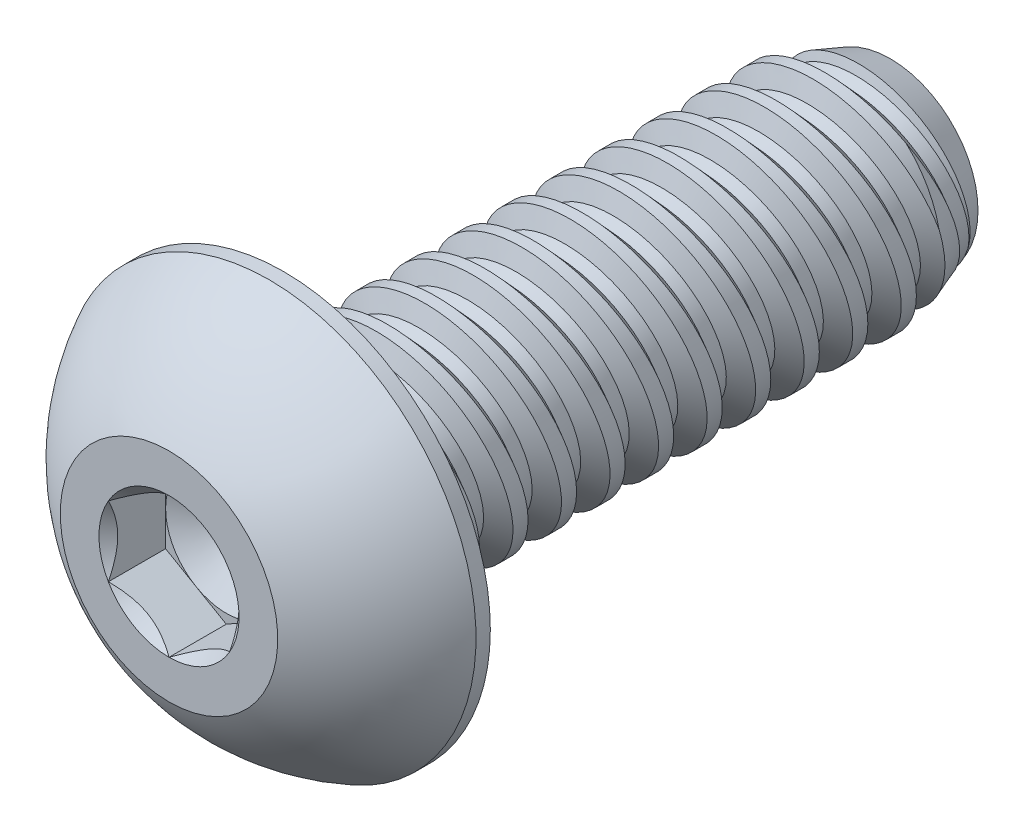
from build123d import *

# Parameters (mm, degrees)
SKETCH1_W          = 7.9375
SKETCH1_H          = 1.4224
LPATTERN1_COUNT    = 13
LPATTERN1_PITCH    = 0.635
LPATTERN2_COUNT    = 2
LPATTERN2_PITCH    = 0.635
SKETCH4_R          = 2.7051
EXTRUDE1_DEPTH     = 1.4986
CUT_EXTRUDE1_DEPTH = 0.7493
SKETCH7_R          = 0.916543552
CUT_EXTRUDE4_DEPTH = 0.7493
CUT_EXTRUDE4_DRAFT = -45
SKETCH8_R          = 0.79375
CUT_EXTRUDE5_DEPTH = 0.249766667
CUT_EXTRUDE5_DRAFT = -60


with BuildPart() as part:
    # Sketch1 → Revolve1 (revolve)
    with BuildSketch(Plane(origin=(0, 0, 0), x_dir=(0, 0, -1), z_dir=(1, 0, 0)), mode=Mode.PRIVATE) as revolve1_sk:
        with Locations((3.96875, 0.7112)):
            Rectangle(SKETCH1_W, SKETCH1_H)
    revolve(revolve1_sk.sketch.rotate(Axis((0, 0, 0), (0, 0, 1)), 125.388824972), axis=Axis((0, 0, 0), (0, 0, 1)))

    # Sketch2 → Cut-Revolve1 (revolve, cut)
    with BuildSketch(Plane(origin=(0, 0, 0), x_dir=(0, 0, -1), z_dir=(1, 0, 0)), mode=Mode.PRIVATE) as cut_revolve1_sk:
        Polygon((0.077468538, 1.439692084), (0.619748307, 1.560736676), (0.500953883, 1.182057853), (0.346016806, 1.147473684), align=None)
    cut_revolve1 = revolve(cut_revolve1_sk.sketch.rotate(Axis((0, -0.152561988, 0), (0, 0.21785303258717023, -0.9759815859905213)), 180), axis=Axis((0, -0.152561988, 0), (0, 0.21785303258717023, -0.9759815859905213)), mode=Mode.SUBTRACT)

    # Sketch3 → Cut-Revolve2 (revolve, cut)
    with BuildSketch(Plane(origin=(0, 0, 0), x_dir=(0, 0, -1), z_dir=(1, 0, 0)), mode=Mode.PRIVATE) as cut_revolve2_sk:
        Polygon((7.9375, 1.147473684), (7.182146156, 1.4224), (7.9375, 1.4224), align=None)
    revolve(cut_revolve2_sk.sketch.rotate(Axis((0, 0, -7.182146156), (0, 0, 1)), 125.388824972), axis=Axis((0, 0, -7.182146156), (0, 0, 1)), mode=Mode.SUBTRACT)

    # LPattern1: Cut-Revolve1 ×13
    with Locations(*[(0, 0, -i * LPATTERN1_PITCH) for i in range(1, LPATTERN1_COUNT)]):
        add(cut_revolve1, mode=Mode.SUBTRACT)

    # LPattern2: Cut-Revolve1 ×2
    with Locations(*[(0, 0, i * LPATTERN2_PITCH) for i in range(1, LPATTERN2_COUNT)]):
        add(cut_revolve1, mode=Mode.SUBTRACT)

    # Sketch4 → Extrude1 (add)
    with BuildSketch(Plane.XY):
        with Locations(Location((0, 0, 0), (0, 0, 90))):
            Circle(SKETCH4_R)
    extrude(amount=EXTRUDE1_DEPTH)

    # Sketch9 → Cut-Revolve3 (revolve, cut)
    with BuildSketch(Plane(origin=(0, 0, 0), x_dir=(0, 0, -1), z_dir=(1, 0, 0)), mode=Mode.PRIVATE) as cut_revolve3_sk:
        with BuildLine():
            Line((0, 2.7051), (-0.187325, 2.7051))
            ThreePointArc((-0.187325, 2.7051), (-0.942390011, 2.16539248), (-1.4986, 1.4224))
            Line((-1.4986, 1.4224), (-1.685925, 1.4224))
            Line((-1.685925, 1.4224), (-1.685925, 2.892425))
            Line((-1.685925, 2.892425), (0, 2.892425))
            Line((0, 2.892425), (0, 2.7051))
        make_face()
    revolve(cut_revolve3_sk.sketch.rotate(Axis((0, 0, 0), (0, 0, 1)), 199.295778605), axis=Axis((0, 0, 0), (0, 0, 1)), mode=Mode.SUBTRACT)

    # Sketch6 → Cut-Extrude1 (cut)
    with BuildSketch(Plane.XY.offset(1.4986)):
        Polygon((0, -0.916543552), (0.79375, -0.458271776), (0.79375, 0.458271776), (0, 0.916543552), (-0.79375, 0.458271776), (-0.79375, -0.458271776), align=None)
    extrude(amount=-CUT_EXTRUDE1_DEPTH, mode=Mode.SUBTRACT)


with BuildPart() as cut_extrude4_tool:
    # Sketch7 → Cut-Extrude4 (with draft: the straight prism first)
    with BuildSketch(Plane.XY.offset(1.4986)):
        Circle(SKETCH7_R)
    extrude(amount=-CUT_EXTRUDE4_DEPTH)
    # Cut-Extrude4: the draft: its side faces are tilted about the plane it starts from
    cut_extrude4_sides = [cut_extrude4_tool.faces().sort_by_distance(p)[0] for p in [
        (-0.916543552, 0, 1.12395),
    ]]
    draft(cut_extrude4_sides, Plane.XY.offset(1.4986), CUT_EXTRUDE4_DRAFT)


with BuildPart() as part_1:
    add(part.part)

    # Cut-Extrude4: cut by cut_extrude4_tool
    add(cut_extrude4_tool.part, mode=Mode.SUBTRACT)


with BuildPart() as cut_extrude5_tool:
    # Sketch8 → Cut-Extrude5 (with draft: the straight prism first)
    with BuildSketch(Plane.XY.offset(0.7493)):
        Circle(SKETCH8_R)
    extrude(amount=-CUT_EXTRUDE5_DEPTH)
    # Cut-Extrude5: the draft: its side faces are tilted about the plane it starts from
    cut_extrude5_sides = [cut_extrude5_tool.faces().sort_by_distance(p)[0] for p in [
        (-0.79375, 0, 0.624416667),
    ]]
    draft(cut_extrude5_sides, Plane.XY.offset(0.7493), CUT_EXTRUDE5_DRAFT)


with BuildPart() as part_2:
    add(part_1.part)

    # Cut-Extrude5: cut by cut_extrude5_tool
    add(cut_extrude5_tool.part, mode=Mode.SUBTRACT)


solid = part_2.part
